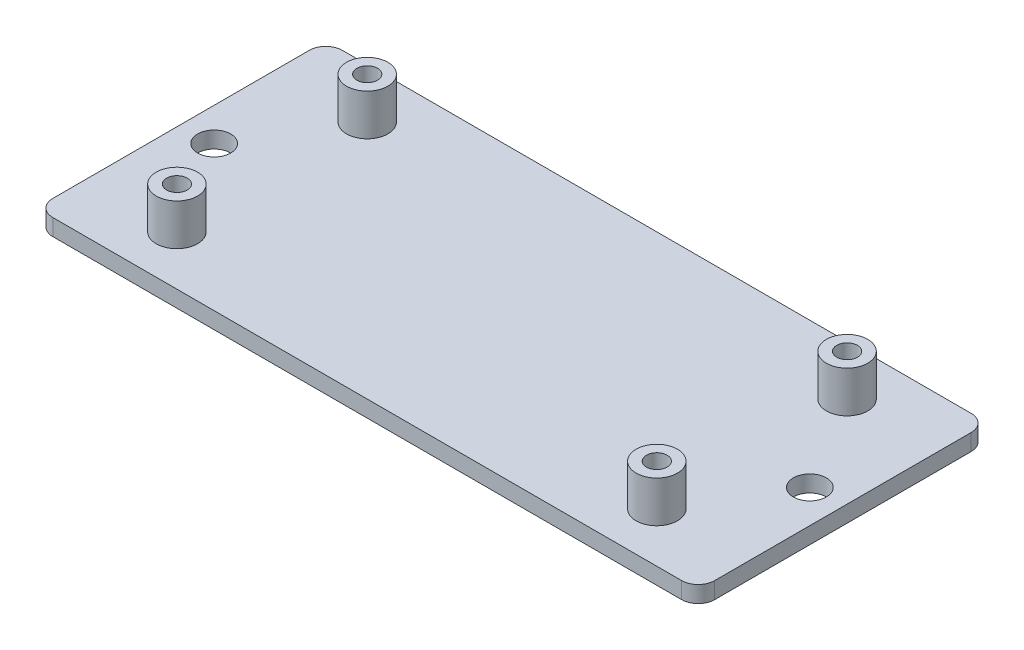
from build123d import *

# Parameters (mm, degrees)
SKETCH_1_W               = 80
SKETCH_1_H               = 35
EXTRUDE_1_DEPTH          = 2
SKETCH_2_R               = 2.5
EXTRUDE_2_DEPTH          = 5
CUT_EXTRUDE_1_DEPTH      = 88.601369852
CUT_EXTRUDE_1_DEPTH_BACK = 88.601369852
SKETCH_3_R               = 1.25
SKETCH_4_R               = 2
CUT_EXTRUDE_2_DEPTH      = 88.464278423
FILLET_1_R               = 2
FILLET_2_R               = 2
FILLET_3_R               = 2
FILLET_4_R               = 2


with BuildPart() as part:
    # Эскиз1 → Бобышка-Вытянуть1 (new body)
    with BuildSketch(Plane(origin=(0, 0, 0), x_dir=(1, 0, 0), z_dir=(0, 1, 0))):
        with Locations((40, -17.5)):
            Rectangle(SKETCH_1_W, SKETCH_1_H)
    extrude(amount=EXTRUDE_1_DEPTH)

    # Эскиз2 → Бобышка-Вытянуть2 (add)
    with BuildSketch(Plane(origin=(0, 2, 0), x_dir=(1, 0, 0), z_dir=(0, 1, 0))):
        with Locations((11, -6)):
            Circle(SKETCH_2_R)
        with Locations((11, -29)):
            Circle(SKETCH_2_R)
        with Locations((69, -6)):
            Circle(SKETCH_2_R)
        with Locations((69, -29)):
            Circle(SKETCH_2_R)
    extrude(amount=EXTRUDE_2_DEPTH)

    # Эскиз3 → Вырез-Вытянуть1 (cut, two sides: drawn at the far end of the back side and taken through both)
    with BuildSketch(Plane(origin=(0, 7, 0), x_dir=(1, 0, 0), z_dir=(0, 1, 0)).offset(-CUT_EXTRUDE_1_DEPTH_BACK)):
        with Locations((11, -6)):
            Circle(SKETCH_3_R)
        with Locations((11, -29)):
            Circle(SKETCH_3_R)
        with Locations((69, -6)):
            Circle(SKETCH_3_R)
        with Locations((69, -29)):
            Circle(SKETCH_3_R)
    extrude(amount=CUT_EXTRUDE_1_DEPTH + CUT_EXTRUDE_1_DEPTH_BACK, mode=Mode.SUBTRACT)

    # Эскиз4 → Вырез-Вытянуть2 (cut, through all)
    with BuildSketch(Plane(origin=(0, 2, 0), x_dir=(1, 0, 0), z_dir=(0, 1, 0))):
        with Locations((4, -17.5)):
            Circle(SKETCH_4_R)
        with Locations((76, -17.5)):
            Circle(SKETCH_4_R)
    extrude(amount=-CUT_EXTRUDE_2_DEPTH, mode=Mode.SUBTRACT)

    # Скругление1
    fillet_1_edges = [part.edges().sort_by_distance(p)[0] for p in [
        (0, 1, 0),
    ]]
    fillet(fillet_1_edges, radius=FILLET_1_R)

    # Скругление2
    fillet_2_edges = [part.edges().sort_by_distance(p)[0] for p in [
        (0, 1, 35),
    ]]
    fillet(fillet_2_edges, radius=FILLET_2_R)

    # Скругление3
    fillet_3_edges = [part.edges().sort_by_distance(p)[0] for p in [
        (80, 1, 35),
    ]]
    fillet(fillet_3_edges, radius=FILLET_3_R)

    # Скругление4
    fillet_4_edges = [part.edges().sort_by_distance(p)[0] for p in [
        (80, 1, 0),
    ]]
    fillet(fillet_4_edges, radius=FILLET_4_R)


solid = part.part
